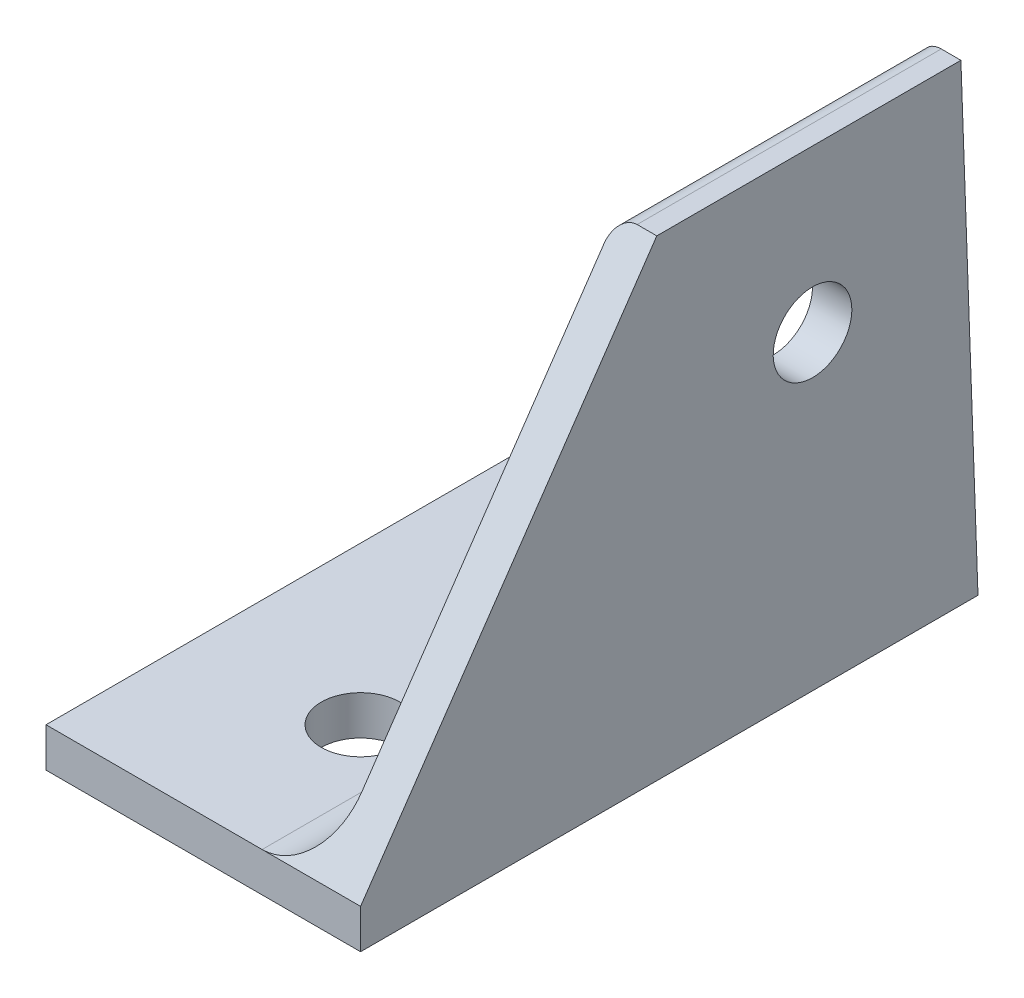
from build123d import *

# Parameters (mm, degrees)
BOSS_EXTRUDE1_DEPTH = 25.4
SKETCH3_R           = 3.175
SKETCH3_W           = 12.7
SKETCH3_H           = 50.8
CUT_EXTRUDE1_DEPTH  = 50.595085442
SKETCH12_OUTSIDE_W  = 66.478
SKETCH12_OUTSIDE_H  = 53.778
CUT_EXTRUDE2_DEPTH  = 41.659838908
SKETCH13_R          = 3.175
CUT_EXTRUDE3_DEPTH  = 41.659838908
SKETCH14_R          = 6.35
CUT_EXTRUDE4_DEPTH  = 2.54


with BuildPart() as part:
    # Sketch2 → Boss-Extrude1 (new, symmetric)
    with BuildSketch(Plane.XY):
        with BuildLine():
            Line((-19.05, -19.05), (19.05, -19.05))
            Line((19.05, -19.05), (19.05, 19.05))
            Line((19.05, 19.05), (17.4625, 19.05))
            ThreePointArc((17.4625, 19.05), (16.339967985, 18.585032015), (15.875, 17.4625))
            Line((15.875, 17.4625), (15.875, -11.0998))
            ThreePointArc((15.875, -11.0998), (14.476376302, -14.476376302), (11.0998, -15.875))
            Line((11.0998, -15.875), (-17.4625, -15.875))
            ThreePointArc((-17.4625, -15.875), (-18.585032015, -16.339967985), (-19.05, -17.4625))
            Line((-19.05, -17.4625), (-19.05, -19.05))
        make_face()
    extrude(amount=BOSS_EXTRUDE1_DEPTH, both=True)

    # Sketch3 → Cut-Extrude1 (cut, through all)
    with BuildSketch(Plane.XZ.offset(19.05)):
        with Locations((6.35, 12.7)):
            Circle(SKETCH3_R)
        with Locations((6.35, -12.7)):
            Circle(SKETCH3_R)
        with Locations((-12.7, 0)):
            Rectangle(SKETCH3_W, SKETCH3_H)
    extrude(amount=-CUT_EXTRUDE1_DEPTH, mode=Mode.SUBTRACT)

    # Sketch12 outside → Cut-Extrude2 (cut, through all)
    with BuildSketch(Plane(origin=(19.05, 0, 0), x_dir=(0, 0, -1), z_dir=(1, 0, 0))):
        Rectangle(SKETCH12_OUTSIDE_W, SKETCH12_OUTSIDE_H)
        Polygon((23.069354359, 19.05), (24.449518438, -19.05), (-25.4, -19.05), (-25.4, -15.875), (-1.48415665, 19.05), align=None, mode=Mode.SUBTRACT)
    extrude(amount=-CUT_EXTRUDE2_DEPTH, mode=Mode.SUBTRACT)

    # Sketch13 → Cut-Extrude3 (cut, through all)
    with BuildSketch(Plane(origin=(19.05, 0, 0), x_dir=(0, 0, -1), z_dir=(1, 0, 0))):
        with Locations((11.088634042, 6.021904729)):
            Circle(SKETCH13_R)
    extrude(amount=-CUT_EXTRUDE3_DEPTH, mode=Mode.SUBTRACT)

    # Sketch14 → Cut-Extrude4 (cut)
    with BuildSketch(Plane(origin=(0, -15.875, 0), x_dir=(1, 0, 0), z_dir=(0, 1, 0))):
        with Locations((6.35, -12.7)):
            Circle(SKETCH14_R)
        with Locations((6.35, 12.7)):
            Circle(SKETCH14_R)
    extrude(amount=CUT_EXTRUDE4_DEPTH, mode=Mode.SUBTRACT)


solid = part.part
